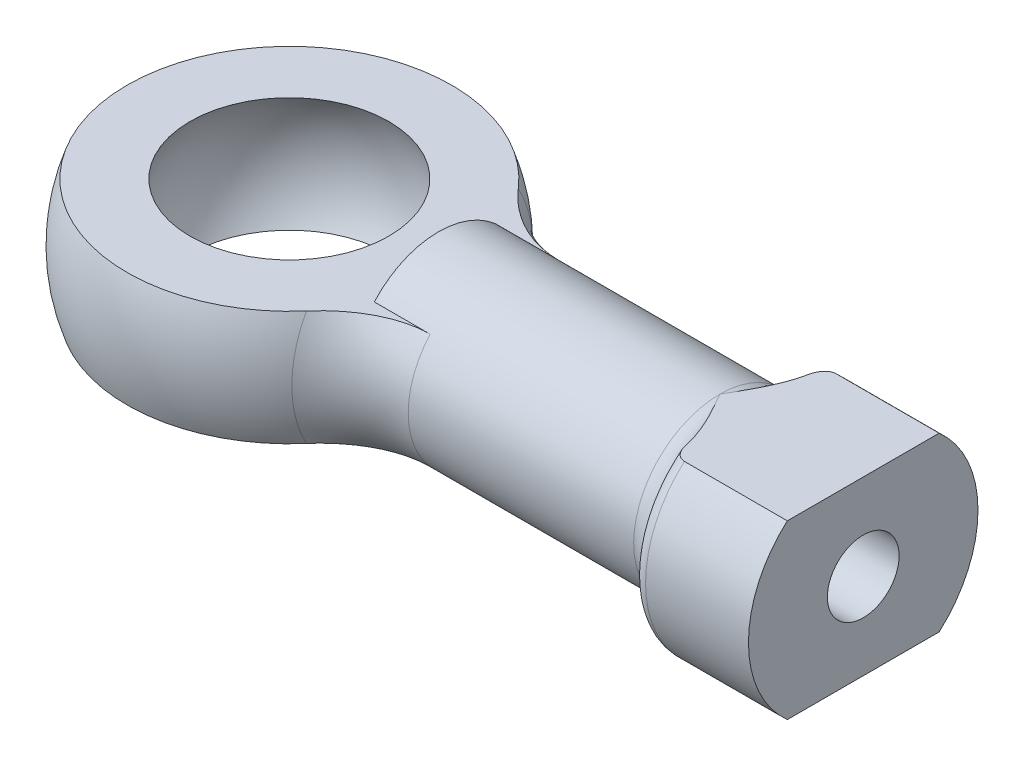
from build123d import *

# Parameters (mm, degrees)
SKETCH_2_R          = 3
EXTRUDE_1_DEPTH     = 16
SKETCH_6_R          = 4
EXTRUDE_2_DEPTH     = 4
FILLET_1_R          = 1
FILLET_2_R          = 0.5
CUT_EXTRUDE_1_DEPTH = 27.981475869
FILLET_3_R          = 4
SKETCH_8_R          = 1.25
CUT_EXTRUDE_2_DEPTH = 8


# Some blends are built 0.0001 mm under size
with BuildPart() as part:
    # 草图1 → 旋转1 (revolve)
    with BuildSketch(Plane.XY):
        with BuildLine():
            Line((0, 6), (0, -6))
            ThreePointArc((0, -6), (6, 0), (0, 6))
        make_face()
    revolve(axis=Axis((0, 6, 0), (0, -1, 0)))

    # 草图2 → 凸台-拉伸1 (add)
    with BuildSketch(Plane(origin=(0, 0, 0), x_dir=(0, 0, -1), z_dir=(1, 0, 0))):
        with Locations(Location((0, 0, 0), (0, 0, 180))):
            Circle(SKETCH_2_R)
    extrude(amount=EXTRUDE_1_DEPTH)

    # 草图4 → 切除-旋转1 (revolve, cut)
    with BuildSketch(Plane.XY):
        with BuildLine():
            Line((0, 6), (0, -6))
            ThreePointArc((0, -6), (-3.464101615, -4.898979486), (-5.656854249, -2))
            Line((-5.656854249, -2), (-3.464101615, -2))
            ThreePointArc((-3.464101615, -2), (-4, 0), (-3.464101615, 2))
            Line((-3.464101615, 2), (-5.656854249, 2))
            ThreePointArc((-5.656854249, 2), (-3.464101615, 4.898979486), (0, 6))
        make_face()
    revolve(axis=Axis((0, 13.897588957, 0), (0, -1, 0)), mode=Mode.SUBTRACT)

    # 草图6 → 凸台-拉伸2 (add)
    with BuildSketch(Plane(origin=(16, 0, 0), x_dir=(0, 0, -1), z_dir=(1, 0, 0))):
        Circle(SKETCH_6_R)
    extrude(amount=EXTRUDE_2_DEPTH)

    # 圆角1
    fillet_1_edges = [part.edges().sort_by_distance(p)[0] for p in [
        (16, 0, -3),
    ]]
    fillet(fillet_1_edges, radius=FILLET_1_R - 0.0001)  # a hair under: the kernel refuses the full size

    # 圆角2
    fillet_2_edges = [part.edges().sort_by_distance(p)[0] for p in [
        (16, 0, 4),
    ]]
    fillet(fillet_2_edges, radius=FILLET_2_R)

    # 草图7 → 切除-拉伸1 (cut, through all)
    with BuildSketch(Plane(origin=(20, 0, 0), x_dir=(0, 0, -1), z_dir=(1, 0, 0))):
        with BuildLine():
            Line((-2.645751311, 3), (2.645751311, 3))
            ThreePointArc((2.645751311, 3), (0, 4), (-2.645751311, 3))
        make_face()
        with BuildLine():
            Line((-2.645751311, -3), (2.645751311, -3))
            ThreePointArc((2.645751311, -3), (0, -4), (-2.645751311, -3))
        make_face()
    extrude(amount=-CUT_EXTRUDE_1_DEPTH, mode=Mode.SUBTRACT)

    # 圆角3
    # the kernel refuses this fillet: 4 mm, written as the material it adds along each edge
    with BuildSketch(Plane(origin=(5.196152423, 0, 0), x_dir=(0, 0.710521844411638, 0.7036751442348125), z_dir=(0, -0.7036751442348125, 0.710521844411638))) as fillet_3_piece_1_section:
        with BuildLine():
            CenterArc((7, -1.945276006), FILLET_3_R, 134.427004001, 45.572995999)
            ThreePointArc((4.2, 0.911295366), (3.628720823, 0.417827906), (3, 0))
            Line((3, 0), (3, -1.945276006))
        make_face()
    fillet_3_piece_1 = revolve(axis=Axis((5.196152423, 0, 0), (-1, 0, 0)), revolution_arc=269.445220203, mode=Mode.PRIVATE)
    fillet_3_piece_1 = split(fillet_3_piece_1, bisect_by=Plane(origin=(5.196152423, -2, 0), z_dir=(0, 1, 0)), keep=Keep.TOP, mode=Mode.PRIVATE)
    fillet_3_piece_1 = split(fillet_3_piece_1, bisect_by=Plane(origin=(5.196152423, 2, 0), z_dir=(0, -1, 0)), keep=Keep.TOP, mode=Mode.PRIVATE)
    add(fillet_3_piece_1)
    with BuildSketch(Plane(origin=(5.196152423, 0, 0), x_dir=(0, -0.7108184662614588, -0.7033755099672631), z_dir=(0, 0.7033755099672631, -0.7108184662614588))) as fillet_3_piece_2_section:
        with BuildLine():
            CenterArc((7, -1.945276006), FILLET_3_R, 134.427004001, 45.572995999)
            ThreePointArc((4.2, 0.911295366), (3.628720823, 0.417827906), (3, 0))
            Line((3, 0), (3, -1.945276006))
        make_face()
    fillet_3_piece_2 = revolve(axis=Axis((5.196152423, 0, 0), (-1, 0, 0)), revolution_arc=134.698452933, mode=Mode.PRIVATE)
    fillet_3_piece_2 = split(fillet_3_piece_2, bisect_by=Plane(origin=(5.196152423, -2, 0), z_dir=(0, 1, 0)), keep=Keep.TOP, mode=Mode.PRIVATE)
    add(fillet_3_piece_2)
    with BuildSketch(Plane(origin=(5.196152423, 0, 0), x_dir=(0, 0, 1), z_dir=(0, -1, 0))) as fillet_3_piece_3_section:
        with BuildLine():
            CenterArc((7, -1.945276006), FILLET_3_R, 134.427004001, 45.572995999)
            ThreePointArc((4.2, 0.911295366), (3.628720823, 0.417827906), (3, 0))
            Line((3, 0), (3, -1.945276006))
        make_face()
    fillet_3_piece_3 = revolve(axis=Axis((5.196152423, 0, 0), (-1, 0, 0)), revolution_arc=134.698452933, mode=Mode.PRIVATE)
    fillet_3_piece_3 = split(fillet_3_piece_3, bisect_by=Plane(origin=(5.196152423, 2, 0), z_dir=(0, -1, 0)), keep=Keep.TOP, mode=Mode.PRIVATE)
    add(fillet_3_piece_3)

    # 草图8 → 切除-拉伸2 (cut)
    with BuildSketch(Plane(origin=(20, 0, 0), x_dir=(0, 0, -1), z_dir=(1, 0, 0))):
        Circle(SKETCH_8_R)
    extrude(amount=-CUT_EXTRUDE_2_DEPTH, mode=Mode.SUBTRACT)


solid = part.part
